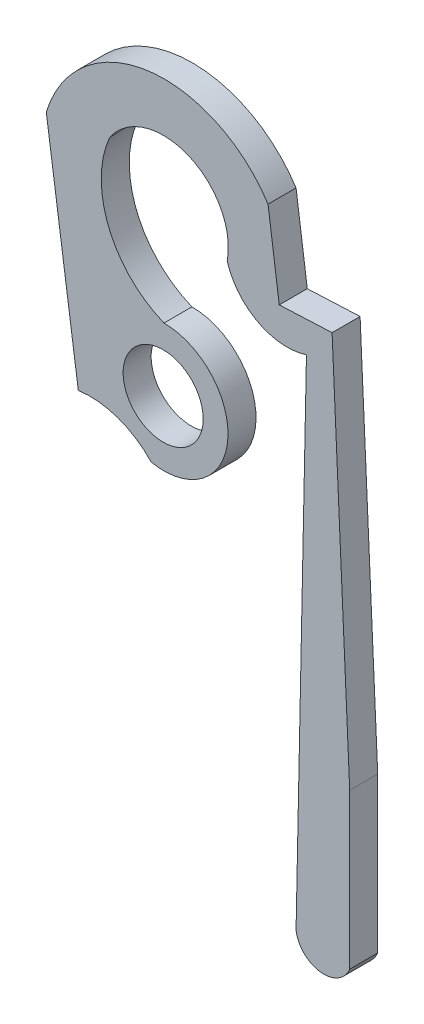
from build123d import *

# Parameters (mm, degrees)
SKETCH1_R           = 1.27
BOSS_EXTRUDE1_DEPTH = 0.889


with BuildPart() as part:
    # Sketch1 → Boss-Extrude1 (new body)
    with BuildSketch(Plane.XY):
        with BuildLine():
            Line((-4.522599649, 7.964720405), (-3.506599649, 0.827320405))
            ThreePointArc((-3.506599649, 0.827320405), (-2.252037224, 0.702060427), (-1.195199649, 0.014520405))
            ThreePointArc((-1.195199649, 0.014520405), (1.232910613, 1.801231457), (-0.788799649, 4.037465668))
            ThreePointArc((-0.788799649, 4.037465668), (-2.541268967, 5.790724788), (-2.515999649, 8.269520405))
            ThreePointArc((-2.515999649, 8.269520405), (-0.026014382, 9.034079311), (1.217800351, 6.745520405))
            ThreePointArc((1.217800351, 6.745520405), (2.196180464, 5.554099851), (3.732400351, 5.424720405))
            Line((3.732400351, 5.424720405), (3.402200351, -10.551879595))
            ThreePointArc((3.402200351, -10.551879595), (4.169433921, -11.311891602), (5.104000351, -10.770734332))
            Line((5.104000351, -10.770734332), (5.104000351, -5.852879595))
            Line((5.104000351, -5.852879595), (4.545200351, 6.440720405))
            Line((4.545200351, 6.440720405), (2.868800351, 6.364520405))
            Line((2.868800351, 6.364520405), (2.513200351, 8.955320405))
            ThreePointArc((2.513200351, 8.955320405), (-1.321826579, 10.712434747), (-4.522599649, 7.964720405))
        make_face()
        with Locations((-0.814199649, 2.021120405)):
            Circle(SKETCH1_R, mode=Mode.SUBTRACT)
    extrude(amount=BOSS_EXTRUDE1_DEPTH)


solid = part.part
